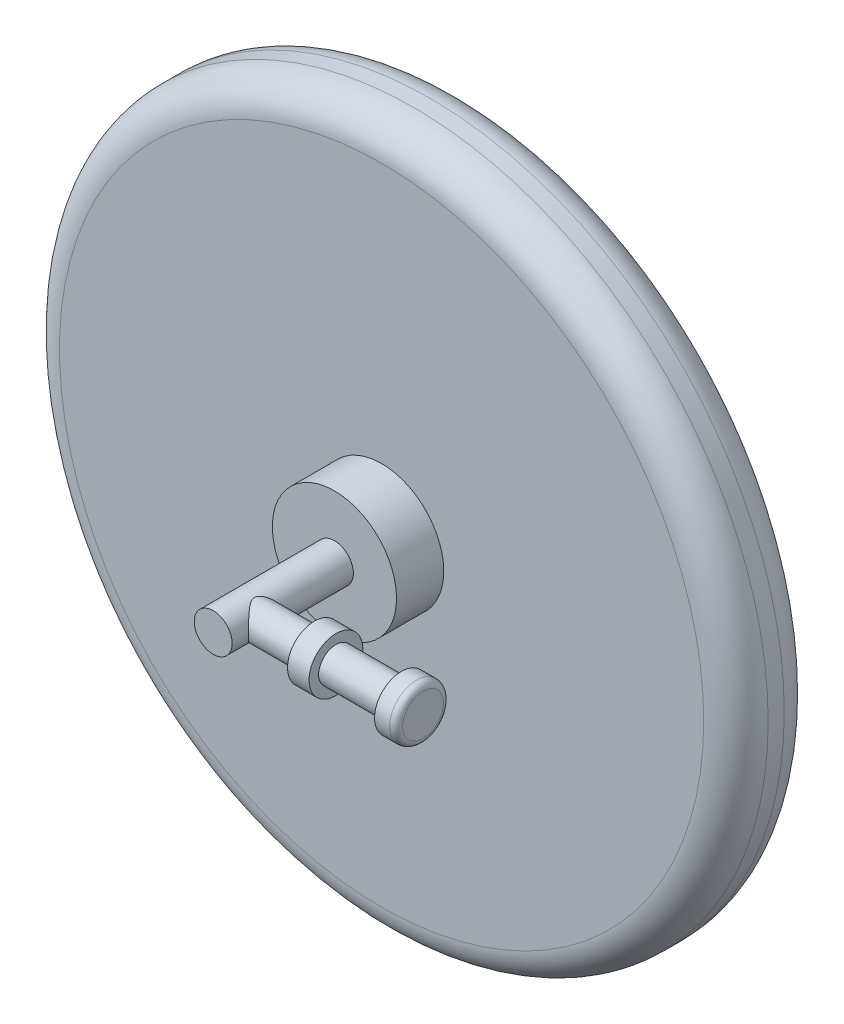
from build123d import *

# Parameters (mm, degrees)
EXTRUSION1_DEPTH      = 25.4
EXTRUSION1_DEPTH_BACK = 38.1
SKETCH1_R             = 279.4
FILLET1_R             = 25.4
SKETCH2_R             = 48.9585
EXTRUSION2_DEPTH      = 37.211
SKETCH3_R             = 14.9225
EXTRUSION3_DEPTH      = 95.6056
SKETCH4_R             = 13.6525
EXTRUSION4_DEPTH      = 133.8072
EXTRUSION5_START      = -80.4672
SKETCH5_R             = 21.209
SKETCH5_R_2           = 13.6525
EXTRUSION5_DEPTH      = 80.4672
EXTRUSION6_START      = -63.5
SKETCH6_R             = 21.209
EXTRUSION6_DEPTH      = 63.5
SKETCH7_R             = 13.6525
EXTRUSION7_DEPTH      = 51.6636
SKETCH8_R             = 21.209
EXTRUSION8_DEPTH      = 17.018
FILLET2_R             = 5.08


with BuildPart() as part:
    # Sketch1 → Extrusion1 (new, two sides: drawn at the far end of the back side and taken through both)
    with BuildSketch(Plane.XY.offset(-EXTRUSION1_DEPTH_BACK)):
        Circle(SKETCH1_R)
    extrude(amount=EXTRUSION1_DEPTH + EXTRUSION1_DEPTH_BACK)

    # Fillet1
    fillet1_edges = [part.edges().sort_by_distance(p)[0] for p in [
        (-279.4, 0, -38.1),
        (-279.4, 0, 25.4),
    ]]
    fillet(fillet1_edges, radius=FILLET1_R - 0.0001)  # a hair under: the kernel refuses the full size

    # Sketch2 → Extrusion2 (add)
    with BuildSketch(Plane.XY.offset(25.4)):
        with Locations(Location((0, 0, 0), (0, 0, 180))):
            Circle(SKETCH2_R)
    extrude(amount=EXTRUSION2_DEPTH)

    # Sketch3 → Extrusion3 (add)
    with BuildSketch(Plane.XY.offset(62.611)):
        Circle(SKETCH3_R)
    extrude(amount=EXTRUSION3_DEPTH)

    # Sketch4 → Extrusion4 (add)
    with BuildSketch(Plane.YZ):
        with Locations(Location((0, 131.7371, 0), (0, 0, 270))):
            Circle(SKETCH4_R)
    extrude(amount=EXTRUSION4_DEPTH)

    # Sketch5 → Extrusion5 (add)
    with BuildSketch(Plane(origin=(133.8072, 0, 0), x_dir=(0, 0, -1), z_dir=(1, 0, 0)).offset(EXTRUSION5_START)):
        with Locations((-131.7371, 0)):
            Circle(SKETCH5_R)
        with Locations(Location((-131.7371, 0, 0), (0, 0, 180))):
            Circle(SKETCH5_R_2, mode=Mode.SUBTRACT)
    extrude(amount=EXTRUSION5_DEPTH)

    # Sketch6 → Extrusion6 (cut)
    with BuildSketch(Plane(origin=(133.8072, 0, 0), x_dir=(0, 0, -1), z_dir=(1, 0, 0)).offset(EXTRUSION6_START)):
        with Locations((-131.7371, 0)):
            Circle(SKETCH6_R)
    extrude(amount=EXTRUSION6_DEPTH, mode=Mode.SUBTRACT)

    # Sketch7 → Extrusion7 (add)
    with BuildSketch(Plane(origin=(70.3072, 0, 0), x_dir=(0, 0, -1), z_dir=(1, 0, 0))):
        with Locations(Location((-131.7371, 0, 0), (0, 0, 180))):
            Circle(SKETCH7_R)
    extrude(amount=EXTRUSION7_DEPTH)

    # Sketch8 → Extrusion8 (add)
    with BuildSketch(Plane(origin=(121.9708, 0, 0), x_dir=(0, 0, -1), z_dir=(1, 0, 0))):
        with Locations((-131.7371, 0)):
            Circle(SKETCH8_R)
    extrude(amount=EXTRUSION8_DEPTH)

    # Fillet2
    fillet2_edges = [part.edges().sort_by_distance(p)[0] for p in [
        (138.9888, 0, 152.9461),
    ]]
    fillet(fillet2_edges, radius=FILLET2_R)


solid = part.part
